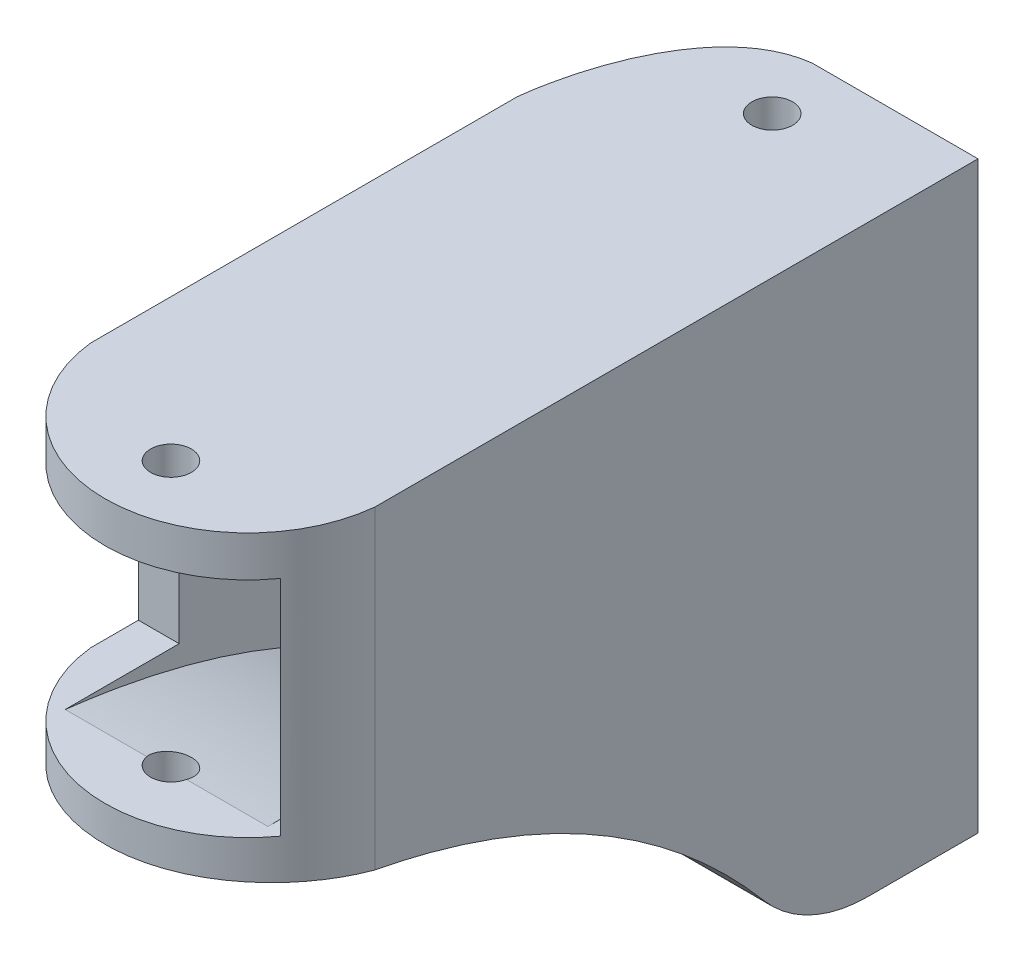
from build123d import *

# Parameters (mm, degrees)
BOSS_EXTRUDE1_DEPTH      = 12
BOSS_EXTRUDE1_DEPTH_BACK = 1
SKETCH1_W                = 20.922356035
SKETCH1_H                = 43
SKETCH14_W               = 14.922356035
SKETCH14_H               = 37
CUT_EXTRUDE6_DEPTH       = 13
SKETCH15_R               = 1.5
CUT_EXTRUDE10_DEPTH      = 43
LOFT8_START              = -19.945599133
LOFT8_DEPTH              = 20.922356013
CUT_EXTRUDE20_DEPTH      = 43
SKETCH22_W               = 16
SKETCH22_H               = 16.433534057
CUT_EXTRUDE21_DEPTH      = 19
CUT_LOFT2_START          = -16.94559915
CUT_LOFT2_DEPTH          = 14.922356033
SKETCH23_R               = 1.5
CUT_EXTRUDE23_DEPTH      = 33
FILLET1_R                = 10


# Read off the part's stored shape, not the designer's step: Loft8, Cut-Loft2
with BuildPart() as part:
    # Sketch1 → Boss-Extrude1 (new, two sides: drawn at the far end of the back side and taken through both)
    with BuildSketch(Plane.XY.offset(-BOSS_EXTRUDE1_DEPTH_BACK)):
        with Locations((-9.484421134, 5.979237668)):
            Rectangle(SKETCH1_W, SKETCH1_H)
    extrude(amount=BOSS_EXTRUDE1_DEPTH + BOSS_EXTRUDE1_DEPTH_BACK)

    # Sketch14 → Cut-Extrude6 (cut)
    with BuildSketch(Plane(origin=(0, 0, -1), x_dir=(-1, 0, 0), z_dir=(0, 0, -1))):
        with Locations((9.484421134, 5.979237668)):
            Rectangle(SKETCH14_W, SKETCH14_H)
    extrude(amount=-CUT_EXTRUDE6_DEPTH, mode=Mode.SUBTRACT)

    # Sketch15 → Cut-Extrude10 (cut)
    with BuildSketch(Plane.XZ.offset(15.520762332)):
        with Locations(Location((-9.484421134, 3.6905228, 0), (0, 0, 270))):
            Circle(SKETCH15_R)
        with BuildLine():
            add(Edge.make_bspline(
                [(-9.484421134, -1), (-16.426209899, -1.809910236), (-19.358305998, 6.878284344), (-19.945599152, 12)],
                knots=[0, 0, 0, 0, 1, 1, 1, 1], degree=3))
            add(Edge.make_bspline(
                [(-19.945599152, 12), (-50.062585738, -15.871811338), (-9.484421134, -1)],
                knots=[0, 0, 0, 1, 1, 1], degree=2))
        make_face()
    extrude(amount=-CUT_EXTRUDE10_DEPTH, mode=Mode.SUBTRACT)

    # Loft8 outline → Loft8 (add)
    with BuildSketch(Plane.YZ.offset(LOFT8_START)):
        with BuildLine():
            add(Edge.make_bspline(
                [(-15.520762333, 12.000000001), (-2.214111033, 21.392948337), (4.785888967, 35.338065027), (5.479237667, 53.835350068)],
                knots=[0, 0, 0, 0, 1, 1, 1, 1], degree=3))
            Line((-15.520762333, 12.000000001), (-12.520762334, 12))
            Line((-12.520762334, 12), (24.479237668, 12.000000002))
            Line((24.479237668, 12.000000002), (27.479237669, 12))
            Line((27.479237669, 12), (27.479237666, 53.835350069))
            Line((27.479237666, 53.835350069), (5.479237667, 53.835350068))
        make_face()
    extrude(amount=LOFT8_DEPTH)

    # Sketch21 → Cut-Extrude20 (cut)
    with BuildSketch(Plane(origin=(0, 27.479237668, 0), x_dir=(1, 0, 0), z_dir=(0, 1, 0))):
        with BuildLine():
            ThreePointArc((-19.945599152, -41.186866189), (-9.484421134, -52.821930397), (0.976756883, -41.186866189))
            add(Edge.make_bspline(
                [(0.976756883, -41.186866189), (22.088375755, -54.528516897), (-10.313654941, -86.662148681), (-35.550608102, -49.144456459), (-19.945599152, -41.186866189)],
                knots=[0, 0, 0, 0, 0.529728329, 1, 1, 1, 1], degree=3))
        make_face()
    extrude(amount=-CUT_EXTRUDE20_DEPTH, mode=Mode.SUBTRACT)

    # Sketch22 → Cut-Extrude21 (cut)
    with BuildSketch(Plane.ZY.offset(19.94559914)):
        with Locations((47.901671706, 16.262470629)):
            Rectangle(SKETCH22_W, SKETCH22_H)
    extrude(amount=-CUT_EXTRUDE21_DEPTH, mode=Mode.SUBTRACT)

    # Cut-Loft2 outline → Cut-Loft2 (cut)
    with BuildSketch(Plane.YZ.offset(CUT_LOFT2_START)):
        with BuildLine():
            add(Edge.make_bspline(
                [(-12.520762331, 12), (-0.657436898, 20.210774423), (6.198051749, 32.307850958), (8.045703611, 48.291229604)],
                knots=[0, 0, 0, 0, 0.898841703, 0.898841703, 0.898841703, 0.898841703], degree=3))
            Line((-12.520762331, 12), (24.47923767, 12))
            Line((24.47923767, 12), (24.47923767, 39.901671701))
            Line((24.47923767, 39.901671701), (8.045703601, 39.901671701))
            Line((8.045703601, 39.901671701), (8.045703611, 48.291229604))
        make_face()
    extrude(amount=CUT_LOFT2_DEPTH, mode=Mode.SUBTRACT)

    # Sketch23 → Cut-Extrude23 (cut)
    with BuildSketch(Plane(origin=(0, 27.479237668, 0), x_dir=(1, 0, 0), z_dir=(0, 1, 0))):
        with Locations(Location((-9.484421063, -47.965150337, 0), (0, 0, 270))):
            Circle(SKETCH23_R)
    extrude(amount=-CUT_EXTRUDE23_DEPTH, mode=Mode.SUBTRACT)

    # Fillet1
    fillet1_edges = [part.edges().sort_by_distance(p)[0] for p in [
        (-9.484421134, -15.520762332, 12),
    ]]
    fillet(fillet1_edges, radius=FILLET1_R)


solid = part.part
